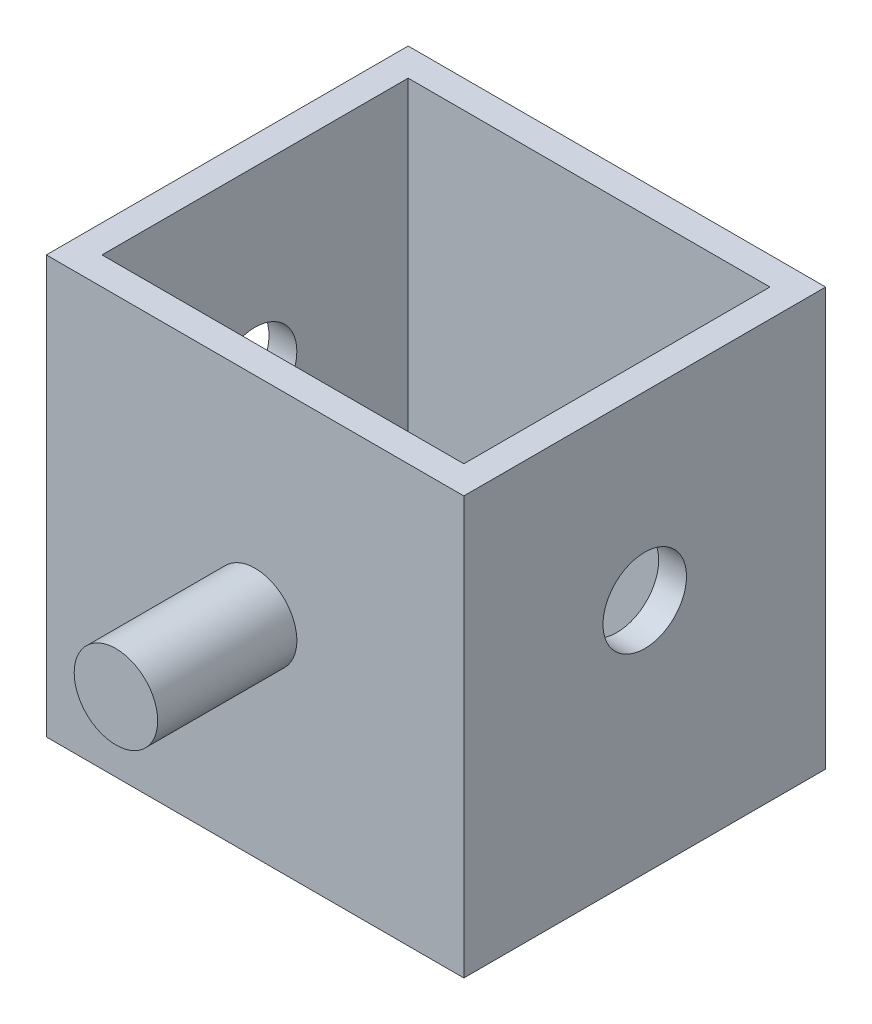
from build123d import *

# Parameters (mm, degrees)
SKETCH1_W          = 38.1
SKETCH1_H          = 38.1
MAIN_BODY_DEPTH    = 33.02
HOLLOW_IT_T        = -2.54
SKETCH3_R          = 3.81
NIBBLE_NO_1_DEPTH  = 12.7
NIBBLE_START       = 12.7
SKETCH4_R          = 3.81
NIBBLE_NO_2_DEPTH  = 12.7
SKETCH5_W          = 1.27
SKETCH5_H          = 3.81
FLAG_DEPTH         = 0.254
SKETCH2_R          = 3.81
NIBBLE_HOLES_DEPTH = 63.488646169


with BuildPart() as part:
    # Sketch1 → main body (new body)
    with BuildSketch(Plane.XY):
        Rectangle(SKETCH1_W, SKETCH1_H)
    extrude(amount=MAIN_BODY_DEPTH)

    # hollow it
    hollow_it_openings = [part.faces().sort_by_distance(p)[0] for p in [
        (0, 19.05, 16.51),
    ]]
    offset(amount=HOLLOW_IT_T, openings=hollow_it_openings, kind=Kind.INTERSECTION)

    # Sketch3 → nibble no 1 (add)
    with BuildSketch(Plane.XY.offset(33.02)):
        Circle(SKETCH3_R)
    extrude(amount=NIBBLE_NO_1_DEPTH)

    # Sketch4 → nibble no 2 (add)
    with BuildSketch(Plane(origin=(0, 0, 0), x_dir=(-1, 0, 0), z_dir=(0, 0, -1)).offset(NIBBLE_START)):
        Circle(SKETCH4_R)
    extrude(amount=-NIBBLE_NO_2_DEPTH)

    # Sketch5 → flag (add)
    with BuildSketch(Plane(origin=(0, 0, 0), x_dir=(-1, 0, 0), z_dir=(0, -1, 0))):
        with Locations((-0.18666561, 6.353298227)):
            Rectangle(SKETCH5_W, SKETCH5_H)
    extrude(amount=FLAG_DEPTH)

    # Sketch2 → nibble holes (cut, through all)
    with BuildSketch(Plane(origin=(19.05, 0, 0), x_dir=(0, 0, -1), z_dir=(1, 0, 0))):
        with Locations((-16.51, 2.54)):
            Circle(SKETCH2_R)
    extrude(amount=-NIBBLE_HOLES_DEPTH, mode=Mode.SUBTRACT)


solid = part.part
